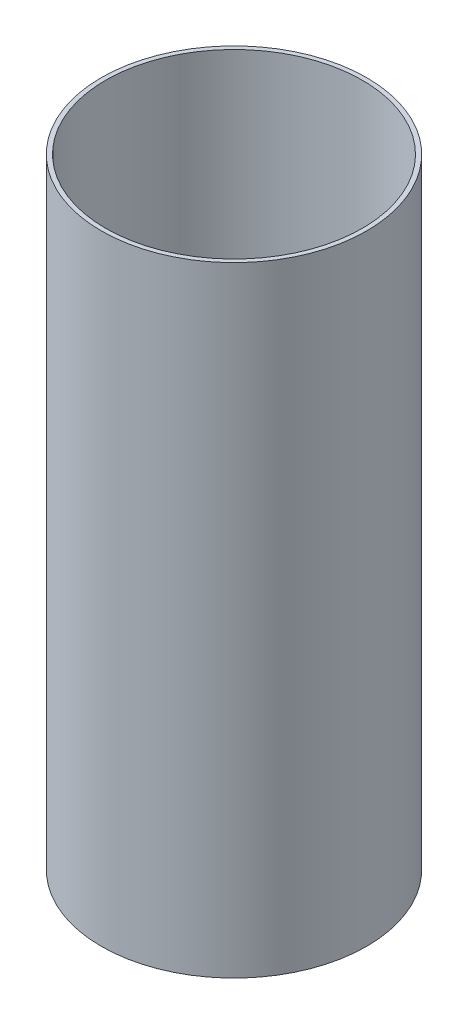
from build123d import *

# Parameters (mm, degrees)
SKETCH1_R           = 76.1746
SKETCH1_R_2         = 73.66
BOSS_EXTRUDE1_DEPTH = 355.6


with BuildPart() as part:
    # Sketch1 → Boss-Extrude1 (new body)
    with BuildSketch(Plane(origin=(0, 0, 0), x_dir=(1, 0, 0), z_dir=(0, 1, 0))):
        Circle(SKETCH1_R)
        Circle(SKETCH1_R_2, mode=Mode.SUBTRACT)
    extrude(amount=BOSS_EXTRUDE1_DEPTH)


solid = part.part
